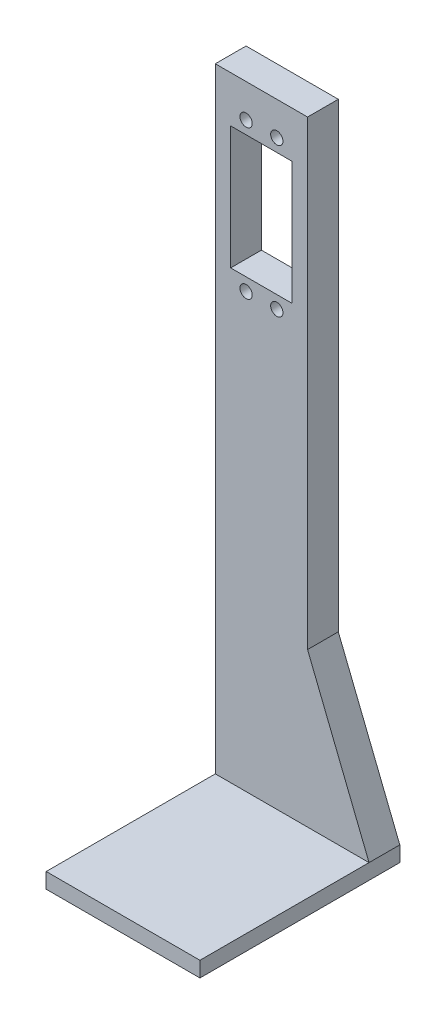
from build123d import *

# Parameters (mm, degrees)
SKETCH1_W           = 50
SKETCH1_H           = 65
BOSS_EXTRUDE1_DEPTH = 5
BOSS_EXTRUDE2_DEPTH = 10
SKETCH3_R           = 2
SKETCH3_W           = 20
SKETCH3_H           = 40
CUT_EXTRUDE1_DEPTH  = 219.059624874


with BuildPart() as part:
    # Sketch1 → Boss-Extrude1 (new body)
    with BuildSketch(Plane(origin=(0, 0, 0), x_dir=(1, 0, 0), z_dir=(0, 1, 0))):
        with Locations((-25, -32.5)):
            Rectangle(SKETCH1_W, SKETCH1_H)
    extrude(amount=BOSS_EXTRUDE1_DEPTH)

    # Sketch2 → Boss-Extrude2 (add)
    with BuildSketch(Plane.XY):
        Polygon((0, 5), (-20, 55), (-20, 205), (-50, 205), (-50, 5), align=None)
    extrude(amount=BOSS_EXTRUDE2_DEPTH)

    # Sketch3 → Cut-Extrude1 (cut, through all)
    with BuildSketch(Plane.XY.offset(10)):
        with Locations((-40, 194.15)):
            Circle(SKETCH3_R)
        with Locations((-30, 194.15)):
            Circle(SKETCH3_R)
        with Locations((-40, 145.85)):
            Circle(SKETCH3_R)
        with Locations((-30, 145.85)):
            Circle(SKETCH3_R)
        with Locations((-35, 170)):
            Rectangle(SKETCH3_W, SKETCH3_H)
    extrude(amount=-CUT_EXTRUDE1_DEPTH, mode=Mode.SUBTRACT)


solid = part.part
